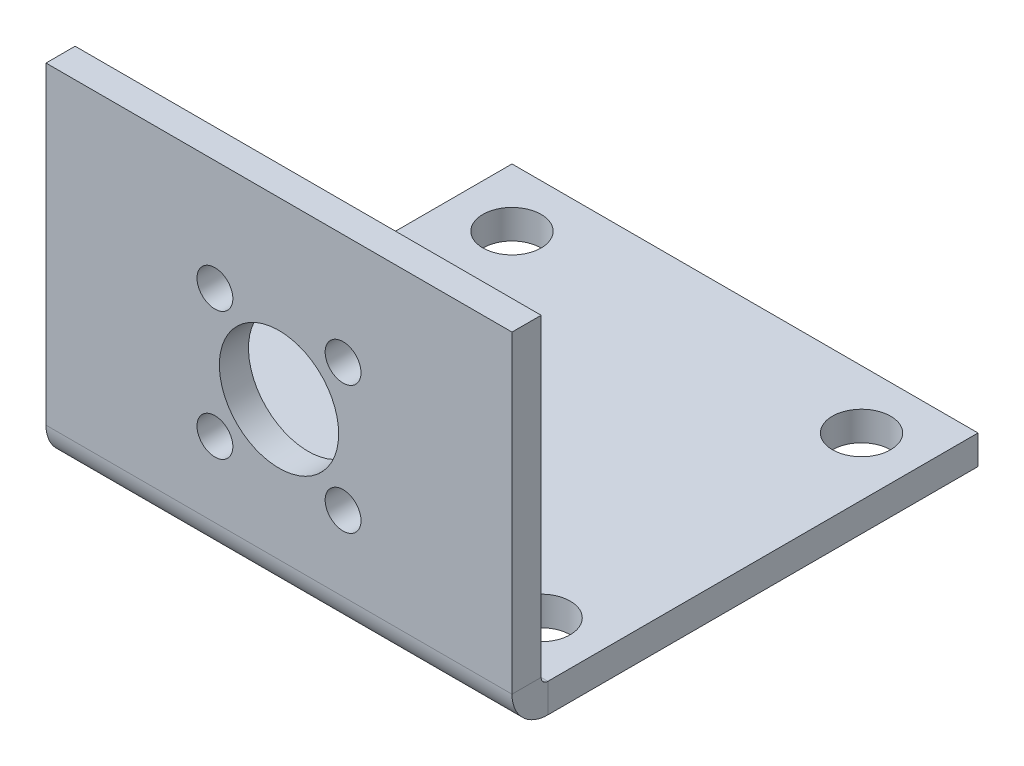
from build123d import *

# Parameters (mm, degrees)
BASE_FLANGE1_DEPTH = 25.4
SKETCH6_R          = 6.5024
SKETCH6_R_2        = 1.95453
CUT_EXTRUDE1_DEPTH = 69.391593051
SKETCH7_R          = 3.175
CUT_EXTRUDE2_DEPTH = 67.675


# Sheet-metal steps are written as plain solids
with BuildPart() as part:
    # Sketch1 → Base-Flange1 (new, symmetric)
    with BuildSketch(Plane(origin=(0, 0, 0), x_dir=(0, 0, -1), z_dir=(1, 0, 0))):
        with BuildLine():
            Line((0, 38.1), (0, 3.9116))
            ThreePointArc((0, 3.9116), (1.145681115, 1.145681115), (3.9116, 0))
            Line((3.9116, 0), (50.8, 0))
            Line((50.8, 0), (50.8, 3.175))
            Line((50.8, 3.175), (3.9116, 3.175))
            ThreePointArc((3.9116, 3.175), (3.390745145, 3.390745145), (3.175, 3.9116))
            Line((3.175, 3.9116), (3.175, 38.1))
            Line((3.175, 38.1), (0, 38.1))
        make_face()
    extrude(amount=BASE_FLANGE1_DEPTH, both=True)

    # Sketch6 → Cut-Extrude1 (cut, through all)
    with BuildSketch(Plane.XY):
        with Locations((0, 19.05)):
            Circle(SKETCH6_R)
        with Locations((-6.985, 26.035)):
            Circle(SKETCH6_R_2)
        with Locations((6.985, 26.035)):
            Circle(SKETCH6_R_2)
        with Locations((6.985, 12.065)):
            Circle(SKETCH6_R_2)
        with Locations((-6.985, 12.065)):
            Circle(SKETCH6_R_2)
    extrude(amount=-CUT_EXTRUDE1_DEPTH, mode=Mode.SUBTRACT)

    # Sketch7 → Cut-Extrude2 (cut, through all)
    with BuildSketch(Plane(origin=(0, 3.175, 0), x_dir=(1, 0, 0), z_dir=(0, 1, 0))):
        with Locations(Location((-19.05, 44.45, 0), (0, 0, 270))):
            Circle(SKETCH7_R)
        with Locations(Location((-19.05, 9.525, 0), (0, 0, 270))):
            Circle(SKETCH7_R)
        with Locations(Location((19.05, 44.45, 0), (0, 0, 270))):
            Circle(SKETCH7_R)
        with Locations(Location((19.05, 9.525, 0), (0, 0, 270))):
            Circle(SKETCH7_R)
    extrude(amount=-CUT_EXTRUDE2_DEPTH, mode=Mode.SUBTRACT)


solid = part.part
